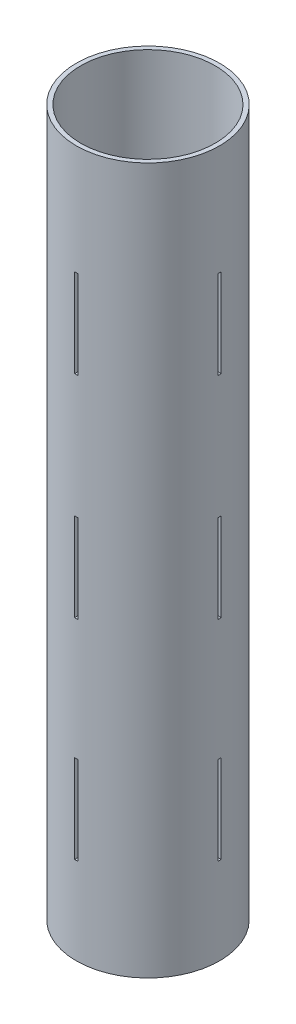
from build123d import *

# Parameters (mm, degrees)
SKETCH1_R           = 32.5
SKETCH1_R_2         = 30.5
BOSS_EXTRUDE1_DEPTH = 320.25
SKETCH2_W           = 1.5
SKETCH2_H           = 40
CUT_EXTRUDE1_DEPTH  = 50
SKETCH3_W           = 1.5
SKETCH3_H           = 40
CUT_EXTRUDE2_DEPTH  = 50


with BuildPart() as part:
    # Sketch1 → Boss-Extrude1 (new body)
    with BuildSketch(Plane(origin=(0, 0, 0), x_dir=(1, 0, 0), z_dir=(0, 1, 0))):
        Circle(SKETCH1_R)
        Circle(SKETCH1_R_2, mode=Mode.SUBTRACT)
    extrude(amount=BOSS_EXTRUDE1_DEPTH)

    # Sketch2 → Cut-Extrude1 (cut, symmetric)
    with BuildSketch(Plane(origin=(0, 0, 0), x_dir=(0, 0, -1), z_dir=(1, 0, 0))):
        with Locations((0, 250.379808483)):
            Rectangle(SKETCH2_W, SKETCH2_H)
        with Locations((0, 154.5)):
            Rectangle(SKETCH2_W, SKETCH2_H)
        with Locations((0, 59.5)):
            Rectangle(SKETCH2_W, SKETCH2_H)
    extrude(amount=CUT_EXTRUDE1_DEPTH, both=True, mode=Mode.SUBTRACT)

    # Sketch3 → Cut-Extrude2 (cut, symmetric)
    with BuildSketch(Plane.XY):
        with Locations((0, 250.379808483)):
            Rectangle(SKETCH3_W, SKETCH3_H)
        with Locations((0, 154.5)):
            Rectangle(SKETCH3_W, SKETCH3_H)
        with Locations((0, 59.5)):
            Rectangle(SKETCH3_W, SKETCH3_H)
    extrude(amount=CUT_EXTRUDE2_DEPTH, both=True, mode=Mode.SUBTRACT)


solid = part.part
